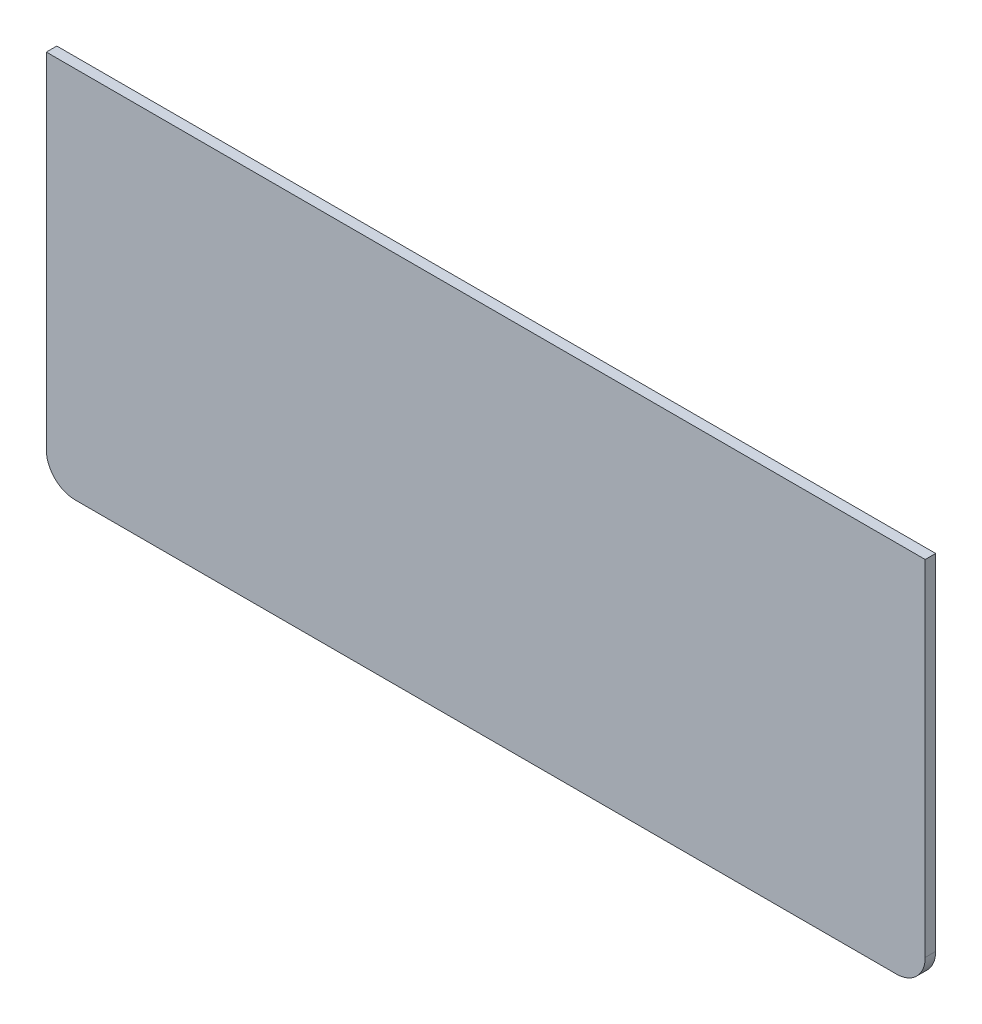
from build123d import *

# Parameters (mm, degrees)
SKETCH2_W           = 266.35
SKETCH2_H           = 113.175
BOSS_EXTRUDE1_DEPTH = 3.175
FILLET1_R           = 8.73125


with BuildPart() as part:
    # Sketch2 → Boss-Extrude1 (new body)
    with BuildSketch(Plane.XY):
        with Locations((79.588397155, -16.051971223)):
            Rectangle(SKETCH2_W, SKETCH2_H)
    extrude(amount=BOSS_EXTRUDE1_DEPTH)

    # Fillet1
    fillet1_edges = [part.edges().sort_by_distance(p)[0] for p in [
        (-53.586602845, -72.639471223, 1.5875),
        (212.763397155, -72.639471223, 1.5875),
    ]]
    fillet(fillet1_edges, radius=FILLET1_R)


solid = part.part
